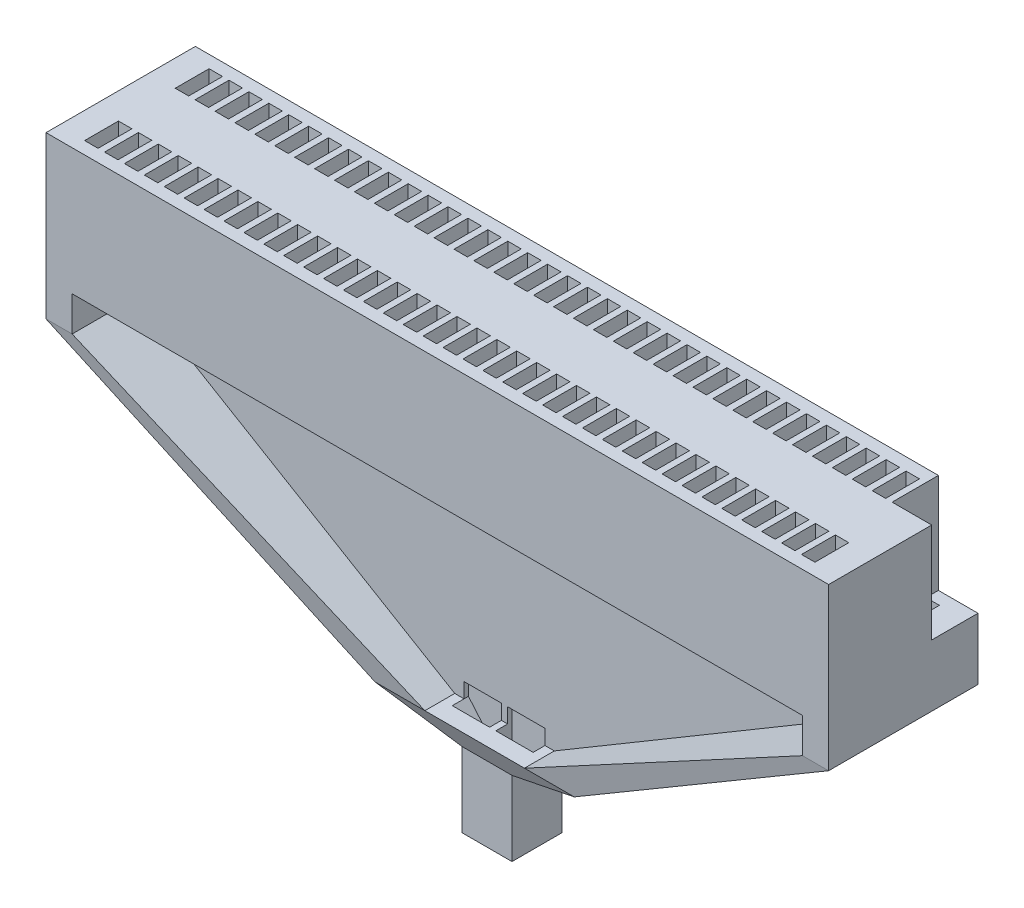
from build123d import *

# Parameters (mm, degrees)
MAIN_BLOCK_W               = 15.72
MAIN_BLOCK_H               = 3
MAIN_WELL_BLOCK_DEPTH      = 2.54
WELL_SKETCH_W              = 0.27
WELL_SKETCH_H              = 0.68
WELLS_DEPTH                = 2.54
SUPPORT_BEAMS_W            = 0.525137189
SUPPORT_BEAMS_H            = 3
SUPPORT_BEAMS_W_2          = 0.5251
SUPPORT_BEAMS_EXTR_DEPTH   = 0.7
WALL_DIVIDER_SKETCH_W      = 14.669725622
WALL_DIVIDER_SKETCH_H      = 0.3
DIVIDER_WALL_EXTR_DEPTH    = 0.7
SKETCH9_W                  = 0.7951
SKETCH9_H                  = 0.93
GND_HOLE_DEPTH             = 2
LOWER_EXIT_BASE_SKETCH_4_W = 1
LOWER_EXIT_BASE_SKETCH_4_H = 1
BOSS_EXTRUDE1_DEPTH        = 1.5
CUT_EXTRUDE1_DEPTH         = 1.5
CUT_EXTRUDE1_DEPTH_BACK    = 0.25
SKETCH12_6_W               = 0.325
SKETCH12_6_H               = 0.325
SKETCH13_7_W               = 0.75
SKETCH13_7_H               = 0.325
CUT_EXTRUDE3_DEPTH         = 0.3


with BuildPart() as part:
    # main block → Main Well Block (new body)
    with BuildSketch(Plane(origin=(0, 0, 0), x_dir=(1, 0, 0), z_dir=(0, 1, 0))):
        Rectangle(MAIN_BLOCK_W, MAIN_BLOCK_H)
    extrude(amount=-MAIN_WELL_BLOCK_DEPTH)

    # well sketch → wells (cut)
    with BuildSketch(Plane(origin=(0, 0, 0), x_dir=(1, 0, 0), z_dir=(0, 1, 0))):
        with Locations((7.1999, 0.91)):
            Rectangle(WELL_SKETCH_W, WELL_SKETCH_H)
        with Locations((6.799919727, 0.91)):
            Rectangle(WELL_SKETCH_W, WELL_SKETCH_H)
        with Locations((6.399939454, 0.91)):
            Rectangle(WELL_SKETCH_W, WELL_SKETCH_H)
        with Locations((5.999959181, 0.91)):
            Rectangle(WELL_SKETCH_W, WELL_SKETCH_H)
        with Locations((5.599978908, 0.91)):
            Rectangle(WELL_SKETCH_W, WELL_SKETCH_H)
        with Locations((5.199998635, 0.91)):
            Rectangle(WELL_SKETCH_W, WELL_SKETCH_H)
        with Locations((4.800018362, 0.91)):
            Rectangle(WELL_SKETCH_W, WELL_SKETCH_H)
        with Locations((4.400038088, 0.91)):
            Rectangle(WELL_SKETCH_W, WELL_SKETCH_H)
        with Locations((4.000057815, 0.91)):
            Rectangle(WELL_SKETCH_W, WELL_SKETCH_H)
        with Locations((3.600077542, 0.91)):
            Rectangle(WELL_SKETCH_W, WELL_SKETCH_H)
        with Locations((3.200097269, 0.91)):
            Rectangle(WELL_SKETCH_W, WELL_SKETCH_H)
        with Locations((2.800116996, 0.91)):
            Rectangle(WELL_SKETCH_W, WELL_SKETCH_H)
        with Locations((2.400136723, 0.91)):
            Rectangle(WELL_SKETCH_W, WELL_SKETCH_H)
        with Locations((2.00015645, 0.91)):
            Rectangle(WELL_SKETCH_W, WELL_SKETCH_H)
        with Locations((1.600176177, 0.91)):
            Rectangle(WELL_SKETCH_W, WELL_SKETCH_H)
        with Locations((1.200195904, 0.91)):
            Rectangle(WELL_SKETCH_W, WELL_SKETCH_H)
        with Locations((0.800215631, 0.91)):
            Rectangle(WELL_SKETCH_W, WELL_SKETCH_H)
        with Locations((0.400235358, 0.91)):
            Rectangle(WELL_SKETCH_W, WELL_SKETCH_H)
        with Locations((0.000255085, 0.91)):
            Rectangle(WELL_SKETCH_W, WELL_SKETCH_H)
        with Locations((-0.399725188, 0.91)):
            Rectangle(WELL_SKETCH_W, WELL_SKETCH_H)
        with Locations((-0.799705462, 0.91)):
            Rectangle(WELL_SKETCH_W, WELL_SKETCH_H)
        with Locations((-1.199685735, 0.91)):
            Rectangle(WELL_SKETCH_W, WELL_SKETCH_H)
        with Locations((-1.599666008, 0.91)):
            Rectangle(WELL_SKETCH_W, WELL_SKETCH_H)
        with Locations((-1.999646281, 0.91)):
            Rectangle(WELL_SKETCH_W, WELL_SKETCH_H)
        with Locations((-2.399626554, 0.91)):
            Rectangle(WELL_SKETCH_W, WELL_SKETCH_H)
        with Locations((-2.799606827, 0.91)):
            Rectangle(WELL_SKETCH_W, WELL_SKETCH_H)
        with Locations((-3.1995871, 0.91)):
            Rectangle(WELL_SKETCH_W, WELL_SKETCH_H)
        with Locations((-3.599567373, 0.91)):
            Rectangle(WELL_SKETCH_W, WELL_SKETCH_H)
        with Locations((-3.999547646, 0.91)):
            Rectangle(WELL_SKETCH_W, WELL_SKETCH_H)
        with Locations((-4.399527919, 0.91)):
            Rectangle(WELL_SKETCH_W, WELL_SKETCH_H)
        with Locations((-4.799508192, 0.91)):
            Rectangle(WELL_SKETCH_W, WELL_SKETCH_H)
        with Locations((-5.199488465, 0.91)):
            Rectangle(WELL_SKETCH_W, WELL_SKETCH_H)
        with Locations((-5.599468738, 0.91)):
            Rectangle(WELL_SKETCH_W, WELL_SKETCH_H)
        with Locations((-5.999449012, 0.91)):
            Rectangle(WELL_SKETCH_W, WELL_SKETCH_H)
        with Locations((-6.399429285, 0.91)):
            Rectangle(WELL_SKETCH_W, WELL_SKETCH_H)
        with Locations((6.799919727, -0.91)):
            Rectangle(WELL_SKETCH_W, WELL_SKETCH_H)
        with Locations((6.399939454, -0.91)):
            Rectangle(WELL_SKETCH_W, WELL_SKETCH_H)
        with Locations((5.999959181, -0.91)):
            Rectangle(WELL_SKETCH_W, WELL_SKETCH_H)
        with Locations((5.599978908, -0.91)):
            Rectangle(WELL_SKETCH_W, WELL_SKETCH_H)
        with Locations((5.199998635, -0.91)):
            Rectangle(WELL_SKETCH_W, WELL_SKETCH_H)
        with Locations((4.800018362, -0.91)):
            Rectangle(WELL_SKETCH_W, WELL_SKETCH_H)
        with Locations((4.400038088, -0.91)):
            Rectangle(WELL_SKETCH_W, WELL_SKETCH_H)
        with Locations((4.000057815, -0.91)):
            Rectangle(WELL_SKETCH_W, WELL_SKETCH_H)
        with Locations((3.600077542, -0.91)):
            Rectangle(WELL_SKETCH_W, WELL_SKETCH_H)
        with Locations((3.200097269, -0.91)):
            Rectangle(WELL_SKETCH_W, WELL_SKETCH_H)
        with Locations((2.800116996, -0.91)):
            Rectangle(WELL_SKETCH_W, WELL_SKETCH_H)
        with Locations((2.400136723, -0.91)):
            Rectangle(WELL_SKETCH_W, WELL_SKETCH_H)
        with Locations((2.00015645, -0.91)):
            Rectangle(WELL_SKETCH_W, WELL_SKETCH_H)
        with Locations((1.600176177, -0.91)):
            Rectangle(WELL_SKETCH_W, WELL_SKETCH_H)
        with Locations((1.200195904, -0.91)):
            Rectangle(WELL_SKETCH_W, WELL_SKETCH_H)
        with Locations((0.800215631, -0.91)):
            Rectangle(WELL_SKETCH_W, WELL_SKETCH_H)
        with Locations((0.400235358, -0.91)):
            Rectangle(WELL_SKETCH_W, WELL_SKETCH_H)
        with Locations((0.000255085, -0.91)):
            Rectangle(WELL_SKETCH_W, WELL_SKETCH_H)
        with Locations((-0.399725188, -0.91)):
            Rectangle(WELL_SKETCH_W, WELL_SKETCH_H)
        with Locations((-0.799705462, -0.91)):
            Rectangle(WELL_SKETCH_W, WELL_SKETCH_H)
        with Locations((-1.199685735, -0.91)):
            Rectangle(WELL_SKETCH_W, WELL_SKETCH_H)
        with Locations((-1.599666008, -0.91)):
            Rectangle(WELL_SKETCH_W, WELL_SKETCH_H)
        with Locations((-1.999646281, -0.91)):
            Rectangle(WELL_SKETCH_W, WELL_SKETCH_H)
        with Locations((-2.399626554, -0.91)):
            Rectangle(WELL_SKETCH_W, WELL_SKETCH_H)
        with Locations((-2.799606827, -0.91)):
            Rectangle(WELL_SKETCH_W, WELL_SKETCH_H)
        with Locations((-3.1995871, -0.91)):
            Rectangle(WELL_SKETCH_W, WELL_SKETCH_H)
        with Locations((-3.599567373, -0.91)):
            Rectangle(WELL_SKETCH_W, WELL_SKETCH_H)
        with Locations((-3.999547646, -0.91)):
            Rectangle(WELL_SKETCH_W, WELL_SKETCH_H)
        with Locations((-4.399527919, -0.91)):
            Rectangle(WELL_SKETCH_W, WELL_SKETCH_H)
        with Locations((-4.799508192, -0.91)):
            Rectangle(WELL_SKETCH_W, WELL_SKETCH_H)
        with Locations((-5.199488465, -0.91)):
            Rectangle(WELL_SKETCH_W, WELL_SKETCH_H)
        with Locations((-5.599468738, -0.91)):
            Rectangle(WELL_SKETCH_W, WELL_SKETCH_H)
        with Locations((-5.999449012, -0.91)):
            Rectangle(WELL_SKETCH_W, WELL_SKETCH_H)
        with Locations((-6.399429285, -0.91)):
            Rectangle(WELL_SKETCH_W, WELL_SKETCH_H)
        with Locations((7.1999, -0.91)):
            Rectangle(WELL_SKETCH_W, WELL_SKETCH_H)
        with Locations((-6.799409558, 0.91)):
            Rectangle(WELL_SKETCH_W, WELL_SKETCH_H)
        with Locations((-7.199389831, 0.91)):
            Rectangle(WELL_SKETCH_W, WELL_SKETCH_H)
        with Locations((-6.799409558, -0.91)):
            Rectangle(WELL_SKETCH_W, WELL_SKETCH_H)
        with Locations((-7.199389831, -0.91)):
            Rectangle(WELL_SKETCH_W, WELL_SKETCH_H)
    extrude(amount=-WELLS_DEPTH, mode=Mode.SUBTRACT)

    # support beams → support beams extr (add)
    with BuildSketch(Plane.XZ.offset(2.54)):
        with Locations((-7.597431406, 0)):
            Rectangle(SUPPORT_BEAMS_W, SUPPORT_BEAMS_H)
        with Locations((7.59745, 0)):
            Rectangle(SUPPORT_BEAMS_W_2, SUPPORT_BEAMS_H)
    extrude(amount=SUPPORT_BEAMS_EXTR_DEPTH)

    # Sketch6 → section 0 of arm1
    with BuildSketch(Plane(origin=(0, -7, 0), x_dir=(1, 0, 0), z_dir=(0, 1, 0)), mode=Mode.PRIVATE) as arm1_s0:
        with BuildLine():
            Line((-2, 0.75), (-1, 0.75))
            Line((-1, 0.75), (-1, -0.75))
            Line((-1, -0.75), (-2, -0.75))
            Line((-2, -0.75), (-2, 0.75))
        make_face()
    # loft up to a face of the part (arm1)
    loft([arm1_s0.sketch, part.faces().sort_by_distance((-7.597431405, -3.24, 0))[0]])

    # Sketch7 → section 0 of arm2
    with BuildSketch(Plane(origin=(0, -7, 0), x_dir=(1, 0, 0), z_dir=(0, 1, 0)), mode=Mode.PRIVATE) as arm2_s0:
        with BuildLine():
            Line((2, 0.75), (1, 0.75))
            Line((1, 0.75), (1, -0.75))
            Line((1, -0.75), (2, -0.75))
            Line((2, -0.75), (2, 0.75))
        make_face()
    # loft up to a face of the part (arm2)
    loft([arm2_s0.sketch, part.faces().sort_by_distance((7.59745, -3.24, 0))[0]])

    # wall divider sketch → divider wall extr (add)
    with BuildSketch(Plane(origin=(0, -2.54, 0), x_dir=(-1, 0, 0), z_dir=(0, -1, 0))):
        Rectangle(WALL_DIVIDER_SKETCH_W, WALL_DIVIDER_SKETCH_H)
    extrude(amount=DIVIDER_WALL_EXTR_DEPTH)

    # Sketch8 → section 1 of divider_wall
    with BuildSketch(Plane(origin=(0, -7, 0), x_dir=(1, 0, 0), z_dir=(0, 1, 0)), mode=Mode.PRIVATE) as divider_wall_s1:
        with BuildLine():
            Line((1.746925483, 0.15), (-1.746925483, 0.15))
            Line((-1.746925483, 0.15), (-1.746925483, -0.15))
            Line((-1.746925483, -0.15), (1.746925483, -0.15))
            Line((1.746925483, -0.15), (1.746925483, 0.15))
        make_face()
    # loft from a face of the part (divider_wall)
    loft([part.faces().sort_by_distance((0, -3.24, 0))[0], divider_wall_s1.sketch])

    # exit base: read off the stored shape, not the designer's step
    # exit base: loft between two sections, ruled curve by curve
    exit_base_from = [
        Edge.make_line((-2, -7, 0.75), (-2, -7, -0.75)),
        Edge.make_line((2, -7, -0.75), (2, -7, 0.75)),
        Edge.make_line((2, -7, -0.75), (-2, -7, -0.75)),
        Edge.make_line((2, -7, 0.75), (-2, -7, 0.75)),
    ]
    exit_base_to = [
        Edge.make_line((-0.5, -7.5, 0.5), (-0.5, -7.5, -0.5)),
        Edge.make_line((0.5, -7.5, -0.5), (0.5, -7.5, 0.5)),
        Edge.make_line((0.5, -7.5, -0.5), (-0.5, -7.5, -0.5)),
        Edge.make_line((0.5, -7.5, 0.5), (-0.5, -7.5, 0.5)),
    ]
    exit_base = Solid(Shell([*[Face.make_surface_from_curves(exit_base_from[k], exit_base_to[k]) for k in range(4)], Face(Wire(exit_base_from)), Face(Wire(exit_base_to))]))
    add(exit_base)

    # Sketch9 → gnd hole (cut)
    with BuildSketch(Plane(origin=(0, 0, 0), x_dir=(1, 0, 0), z_dir=(0, 1, 0))):
        with Locations((7.46245, 1.035)):
            Rectangle(SKETCH9_W, SKETCH9_H)
    extrude(amount=-GND_HOLE_DEPTH, mode=Mode.SUBTRACT)

    # Sketch13 → Cut-Loft2 section 0
    with BuildSketch(Plane(origin=(0, -7, 0), x_dir=(1, 0, 0), z_dir=(0, 1, 0))):
        with BuildLine():
            Line((0.0625, -0.0625), (0.8125, -0.0625))
            Line((0.8125, -0.0625), (0.8125, -0.3875))
            Line((0.8125, -0.3875), (0.0625, -0.3875))
            Line((0.0625, -0.3875), (0.0625, -0.0625))
        make_face()
    # Sketch12 → Cut-Loft2 section 1
    with BuildSketch(Plane(origin=(0, -7.5, 0), x_dir=(-1, 0, 0), z_dir=(0, -1, 0))):
        with BuildLine():
            Line((-0.3875, -0.3875), (-0.0625, -0.3875))
            Line((-0.0625, -0.3875), (-0.0625, -0.0625))
            Line((-0.0625, -0.0625), (-0.3875, -0.0625))
            Line((-0.3875, -0.0625), (-0.3875, -0.3875))
        make_face()
    loft(mode=Mode.SUBTRACT)

    # Sketch13<3> → Cut-Loft3 section 0
    with BuildSketch(Plane(origin=(0, -7, 0), x_dir=(1, 0, 0), z_dir=(0, 1, 0))):
        with BuildLine():
            Line((-0.8125, -0.3875), (-0.0625, -0.3875))
            Line((-0.0625, -0.3875), (-0.0625, -0.0625))
            Line((-0.0625, -0.0625), (-0.8125, -0.0625))
            Line((-0.8125, -0.0625), (-0.8125, -0.3875))
        make_face()
    # Sketch12<3> → Cut-Loft3 section 1
    with BuildSketch(Plane(origin=(0, -7.5, 0), x_dir=(-1, 0, 0), z_dir=(0, -1, 0))):
        with BuildLine():
            Line((0.0625, -0.3875), (0.3875, -0.3875))
            Line((0.3875, -0.3875), (0.3875, -0.0625))
            Line((0.3875, -0.0625), (0.0625, -0.0625))
            Line((0.0625, -0.0625), (0.0625, -0.3875))
        make_face()
    loft(mode=Mode.SUBTRACT)

    # Sketch13<4> → Cut-Loft4 section 0
    with BuildSketch(Plane(origin=(0, -7, 0), x_dir=(1, 0, 0), z_dir=(0, 1, 0))):
        with BuildLine():
            Line((0.0625, 0.0625), (0.8125, 0.0625))
            Line((0.8125, 0.0625), (0.8125, 0.3875))
            Line((0.8125, 0.3875), (0.0625, 0.3875))
            Line((0.0625, 0.3875), (0.0625, 0.0625))
        make_face()
    # Sketch12<4> → Cut-Loft4 section 1
    with BuildSketch(Plane(origin=(0, -7.5, 0), x_dir=(-1, 0, 0), z_dir=(0, -1, 0))):
        with BuildLine():
            Line((-0.3875, 0.3875), (-0.0625, 0.3875))
            Line((-0.0625, 0.3875), (-0.0625, 0.0625))
            Line((-0.0625, 0.0625), (-0.3875, 0.0625))
            Line((-0.3875, 0.0625), (-0.3875, 0.3875))
        make_face()
    loft(mode=Mode.SUBTRACT)

    # Sketch13<5> → Cut-Loft5 section 0
    with BuildSketch(Plane(origin=(0, -7, 0), x_dir=(1, 0, 0), z_dir=(0, 1, 0))):
        with BuildLine():
            Line((-0.8125, 0.0625), (-0.0625, 0.0625))
            Line((-0.0625, 0.0625), (-0.0625, 0.3875))
            Line((-0.0625, 0.3875), (-0.8125, 0.3875))
            Line((-0.8125, 0.3875), (-0.8125, 0.0625))
        make_face()
    # Sketch12<5> → Cut-Loft5 section 1
    with BuildSketch(Plane(origin=(0, -7.5, 0), x_dir=(-1, 0, 0), z_dir=(0, -1, 0))):
        with BuildLine():
            Line((0.0625, 0.0625), (0.3875, 0.0625))
            Line((0.3875, 0.0625), (0.3875, 0.3875))
            Line((0.3875, 0.3875), (0.0625, 0.3875))
            Line((0.0625, 0.3875), (0.0625, 0.0625))
        make_face()
    loft(mode=Mode.SUBTRACT)

    # lower exit base sketch<4> → Boss-Extrude1 (add)
    with BuildSketch(Plane(origin=(0, -7.5, 0), x_dir=(1, 0, 0), z_dir=(0, 1, 0))):
        Rectangle(LOWER_EXIT_BASE_SKETCH_4_W, LOWER_EXIT_BASE_SKETCH_4_H)
    extrude(amount=-BOSS_EXTRUDE1_DEPTH)

    # Sketch12<6> → Cut-Extrude1 (cut, two sides: drawn at the far end of the back side and taken through both)
    with BuildSketch(Plane(origin=(0, -7.5, 0), x_dir=(-1, 0, 0), z_dir=(0, -1, 0)).offset(-CUT_EXTRUDE1_DEPTH_BACK)):
        with Locations((0.225, 0.225)):
            Rectangle(SKETCH12_6_W, SKETCH12_6_H)
        with Locations((-0.225, 0.225)):
            Rectangle(SKETCH12_6_W, SKETCH12_6_H)
        with Locations((0.225, -0.225)):
            Rectangle(SKETCH12_6_W, SKETCH12_6_H)
        with Locations((-0.225, -0.225)):
            Rectangle(SKETCH12_6_W, SKETCH12_6_H)
    extrude(amount=CUT_EXTRUDE1_DEPTH + CUT_EXTRUDE1_DEPTH_BACK, mode=Mode.SUBTRACT)

    # Sketch13<7> → Cut-Extrude3 (cut)
    with BuildSketch(Plane(origin=(0, -7, 0), x_dir=(1, 0, 0), z_dir=(0, 1, 0))):
        with Locations((-0.4375, -0.225)):
            Rectangle(SKETCH13_7_W, SKETCH13_7_H)
        with Locations((0.4375, -0.225)):
            Rectangle(SKETCH13_7_W, SKETCH13_7_H)
        with Locations((-0.4375, 0.225)):
            Rectangle(SKETCH13_7_W, SKETCH13_7_H)
        with Locations((0.4375, 0.225)):
            Rectangle(SKETCH13_7_W, SKETCH13_7_H)
    extrude(amount=CUT_EXTRUDE3_DEPTH, mode=Mode.SUBTRACT)


solid = part.part
